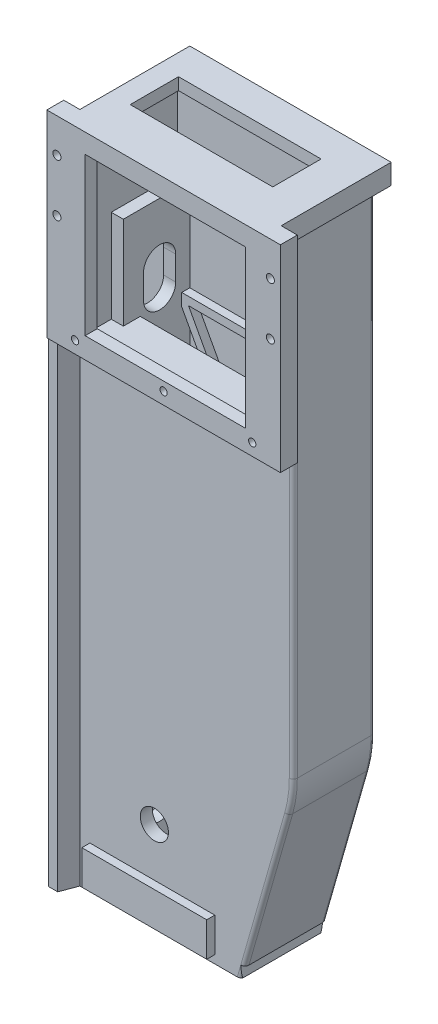
from build123d import *
from OCP.BRepFilletAPI import BRepFilletAPI_MakeChamfer

# Parameters (mm, degrees)
EXTRUDE_1_DEPTH     = 50
EXTRUDE_2_DEPTH     = 440
SKETCH_6_W          = 490
SKETCH_6_H          = 203
EXTRUDE_3_DEPTH     = 1220
CUT_EXTRUDE_3_REACH = 1785.009
FILLET_1_R          = 300
FILLET_5_R          = 10
FILLET_6_R          = 10
SKETCH_8_W          = 120
SKETCH_8_H          = 1450
CUT_EXTRUDE_4_DEPTH = 30
SHELL_START         = -255
SHELL_3_DEPTH       = 143
SHELL_START_2       = -112
SHELL_3_2_DEPTH     = 82
SHELL_START_3       = -90
SHELL_3_3_OUTLINE_W = 30
SHELL_3_3_OUTLINE_H = 230
SHELL_3_3_DEPTH     = 60
EXTRUDE_4_DEPTH     = 1450
EXTRUDE_7_DEPTH     = 1450
SKETCH_13_R         = 35
CUT_EXTRUDE_5_DEPTH = 1784.008936163
SKETCH_3_W          = 354
SKETCH_3_H          = 120
CUT_EXTRUDE_1_DEPTH = 50
CUT_EXTRUDE_6_REACH = 1796.449
SKETCH_15_W         = 398
SKETCH_15_H         = 390
CUT_EXTRUDE_7_REACH = 1820.337
SKETCH_18_W         = 270
SKETCH_18_H         = 143
SKETCH_18_W_2       = 180
SKETCH_18_H_2       = 123
EXTRUDE_8_DEPTH     = 30
HOLE_WIZARD_M16_1_D = 14
CHAMFER_1_SIZE      = 2
CHAMFER_1_SIZE2     = 1.480874037
RIB_10_REACH        = 1777.703
SKETCH_25_WALLS_W   = 3953.405843571
SKETCH_25_WALLS_H   = 20
SKETCH_25_WALLS_W_2 = 3946.405843571
RIB_11_REACH        = 1777.703
RIB_12_REACH        = 1775.472
SKETCH_27_WALLS_W   = 3948.943538561
SKETCH_27_WALLS_H   = 20
RIB_13_REACH        = 1775.472
SKETCH_30_W         = 310
SKETCH_30_H         = 85
EXTRUDE_9_DEPTH     = 20
CUT_EXTRUDE_8_REACH = 1796.449
SKETCH_31_R         = 9
SKETCH_31_R_2       = 10
SKETCH_32_R         = 7
CUT_EXTRUDE_9_DEPTH = 30


# Read off the part's stored shape, not the designer's step: 抽壳3
with BuildPart() as part:
    # 草图2 → 凸台-拉伸1 (new body)
    with BuildSketch(Plane(origin=(0, 0, 0), x_dir=(1, 0, 0), z_dir=(0, 1, 0))):
        Polygon((-163.111685896, 0), (416.888314104, 0), (416.888314104, 42), (376.888314104, 42), (376.888314104, 315), (-123.111685896, 315), (-123.111685896, 42), (-163.111685896, 42), align=None)
    extrude(amount=-EXTRUDE_1_DEPTH)

    # 草图5 → 凸台-拉伸2 (add)
    with BuildSketch(Plane.XZ.offset(50)):
        Polygon((-123.111685896, -285), (366.888314104, -285), (366.888314104, -42), (416.888314104, -42), (416.888314104, 0), (-163.111685896, 0), (-163.111685896, -42), (-123.111685896, -42), align=None)
    extrude(amount=EXTRUDE_2_DEPTH)

    # 草图6 → 凸台-拉伸3 (add)
    with BuildSketch(Plane.XZ.offset(490)):
        with Locations((121.888314104, -183.5)):
            Rectangle(SKETCH_6_W, SKETCH_6_H)
    extrude(amount=EXTRUDE_3_DEPTH)

    # 草图7 → 切除-拉伸3 (cut, up to next)
    with BuildSketch(Plane(origin=(0, 0, -285), x_dir=(-1, 0, 0), z_dir=(0, 0, -1)), mode=Mode.PRIVATE) as cut_extrude_3_sk1:
        Polygon((-236.888314104, -1680), (-246.888314104, -1680), (-366.888314104, -1260), (-366.888314104, -1710), (-236.888314104, -1710), align=None)
    cut_extrude_3_tool1 = extrude(cut_extrude_3_sk1.sketch, amount=-CUT_EXTRUDE_3_REACH, mode=Mode.PRIVATE) & part.part
    add(cut_extrude_3_tool1.solids().sort_by_distance((323.537799, -1560.773196, -285))[0], mode=Mode.SUBTRACT)

    # 圆角1
    fillet_1_edges = [part.edges().sort_by_distance(p)[0] for p in [
        (366.888314104, -1260, -183.5),
    ]]
    fillet(fillet_1_edges, radius=FILLET_1_R)

    # 圆角5
    fillet_5_edges = [part.edges().sort_by_distance(p)[0] for p in [
        (366.888314104, -633.991758304, -285),
        (363.988596237, -1259.593880175, -285),
        (301.11690625, -1490.199927489, -285),
    ]]
    fillet(fillet_5_edges, radius=FILLET_5_R)

    # 圆角6
    fillet_6_edges = [part.edges().sort_by_distance(p)[0] for p in [
        (301.11690625, -1490.199927489, -82),
        (363.988596237, -1259.593880175, -82),
        (366.888314104, -853.991758304, -82),
    ]]
    fillet(fillet_6_edges, radius=FILLET_6_R)

    # 草图8 → 切除-拉伸4 (cut)
    with BuildSketch(Plane.ZY.offset(123.111685896)):
        with Locations((-180, -985)):
            Rectangle(SKETCH_8_W, SKETCH_8_H)
    extrude(amount=-CUT_EXTRUDE_4_DEPTH, mode=Mode.SUBTRACT)

    # 抽壳3 outline → 抽壳3 (cut)
    with BuildSketch(Plane.XY.offset(SHELL_START)):
        with BuildLine():
            Line((336.888314104, -30), (-93.111685896, -30))
            Line((-93.111685896, -30), (-93.111685896, -230))
            Line((-93.111685896, -230), (-63.111685896, -230))
            Line((-63.111685896, -230), (-63.111685896, -1710))
            Line((-63.111685896, -1710), (206.888314104, -1710))
            Line((206.888314104, -1710), (206.888314104, -1650))
            Line((206.888314104, -1650), (224.259271721, -1650))
            Line((224.259271721, -1650), (326.499779967, -1292.15822114))
            ThreePointArc((326.499779967, -1292.15822114), (334.278568024, -1255.432843818), (336.888314104, -1217.983516608))
            Line((336.888314104, -1217.983516608), (336.888314104, -30))
        make_face()
    extrude(amount=SHELL_3_DEPTH, mode=Mode.SUBTRACT)

    # Shell 3 2 outline → Shell 3 2 (cut)
    with BuildSketch(Plane.XY.offset(SHELL_START_2)):
        Polygon((336.888314104, -460), (336.888314104, -30), (-93.111685896, -30), (-93.111685896, -230), (-63.111685896, -230), (-63.111685896, -460), align=None)
    extrude(amount=SHELL_3_2_DEPTH, mode=Mode.SUBTRACT)

    # Shell 3 3 outline → Shell 3 3 (cut)
    with BuildSketch(Plane.XY.offset(SHELL_START_3)):
        with Locations((-78.111685896, -345)):
            Rectangle(SHELL_3_3_OUTLINE_W, SHELL_3_3_OUTLINE_H)
    extrude(amount=SHELL_3_3_DEPTH, mode=Mode.SUBTRACT)

    # 草图9 → 凸台-拉伸4 (add)
    with BuildSketch(Plane(origin=(0, -260, 0), x_dir=(1, 0, 0), z_dir=(0, 1, 0))):
        Polygon((-123.111685896, 285), (-153.111685896, 285), (-168.111685896, 319.5), (-198.111685896, 319.5), (-198.111685896, 349.5), (-228.111685896, 349.5), (-228.111685896, 227.5), (-191.111685896, 227.5), (-191.111685896, 240), (-123.111685896, 240), align=None)
    extrude(amount=-EXTRUDE_4_DEPTH)

    # 草图12 → 凸台-拉伸7 (add)
    with BuildSketch(Plane.XZ.offset(1710)):
        Polygon((-123.111685896, -82), (-163.111685896, -82), (-178.111685896, -42), (-203.111685896, -42), (-203.111685896, -82), (-198.686479123, -84.327562032), (-201.014041155, -88.752768805), (-228.111685896, -74.5), (-228.111685896, -139.5), (-191.111685896, -139.5), (-191.111685896, -127), (-176.111685896, -127), (-176.111685896, -120), (-123.111685896, -120), align=None)
    extrude(amount=-EXTRUDE_7_DEPTH)

    # 草图13 → 切除-拉伸5 (cut, through all)
    with BuildSketch(Plane(origin=(0, 0, -285), x_dir=(-1, 0, 0), z_dir=(0, 0, -1))):
        with Locations((-21.888314104, -1485)):
            Circle(SKETCH_13_R)
        with Locations((-21.888314104, -265)):
            Circle(SKETCH_13_R)
    extrude(amount=-CUT_EXTRUDE_5_DEPTH, mode=Mode.SUBTRACT)

    # 草图3 → 切除-拉伸1 (cut)
    with BuildSketch(Plane(origin=(0, 0, 0), x_dir=(1, 0, 0), z_dir=(0, 1, 0))):
        with Locations((105.888314104, 175)):
            Rectangle(SKETCH_3_W, SKETCH_3_H)
    extrude(amount=-CUT_EXTRUDE_1_DEPTH, mode=Mode.SUBTRACT)

    # 草图15 → 切除-拉伸6 (cut, up to next)
    with BuildSketch(Plane.XY, mode=Mode.PRIVATE) as cut_extrude_6_sk1:
        with Locations((130.888314104, -243)):
            Rectangle(SKETCH_15_W, SKETCH_15_H)
    cut_extrude_6_tool1 = extrude(cut_extrude_6_sk1.sketch, amount=-CUT_EXTRUDE_6_REACH, mode=Mode.PRIVATE) & part.part
    add(cut_extrude_6_tool1.solids().sort_by_distance((130.888314, -243, 0))[0], mode=Mode.SUBTRACT)

    # 草图17 → 切除-拉伸7 (cut, up to next)
    with BuildSketch(Plane.ZY.offset(93.111685896), mode=Mode.PRIVATE) as cut_extrude_7_sk1:
        with BuildLine():
            Line((-140, -370), (-140, -430))
            ThreePointArc((-140, -430), (-180, -470), (-220, -430))
            Line((-220, -430), (-220, -370))
            ThreePointArc((-220, -370), (-180, -330), (-140, -370))
        make_face()
    cut_extrude_7_tool1 = extrude(cut_extrude_7_sk1.sketch, amount=-CUT_EXTRUDE_7_REACH, mode=Mode.PRIVATE) & part.part
    # 草图17 → 切除-拉伸7 (cut, up to next)
    with BuildSketch(Plane.ZY.offset(93.111685896), mode=Mode.PRIVATE) as cut_extrude_7_sk2:
        with BuildLine():
            Line((-140, -600), (-140, -720))
            ThreePointArc((-140, -720), (-180, -760), (-220, -720))
            Line((-220, -720), (-220, -600))
            ThreePointArc((-220, -600), (-180, -560), (-140, -600))
        make_face()
    cut_extrude_7_tool2 = extrude(cut_extrude_7_sk2.sketch, amount=-CUT_EXTRUDE_7_REACH, mode=Mode.PRIVATE) & part.part
    # 草图17 → 切除-拉伸7 (cut, up to next)
    with BuildSketch(Plane.ZY.offset(93.111685896), mode=Mode.PRIVATE) as cut_extrude_7_sk3:
        with BuildLine():
            Line((-140, -1120), (-140, -1000))
            ThreePointArc((-140, -1000), (-180, -960), (-220, -1000))
            Line((-220, -1000), (-220, -1120))
            ThreePointArc((-220, -1120), (-180, -1160), (-140, -1120))
        make_face()
    cut_extrude_7_tool3 = extrude(cut_extrude_7_sk3.sketch, amount=-CUT_EXTRUDE_7_REACH, mode=Mode.PRIVATE) & part.part
    # 草图17 → 切除-拉伸7 (cut, up to next)
    with BuildSketch(Plane.ZY.offset(93.111685896), mode=Mode.PRIVATE) as cut_extrude_7_sk4:
        with BuildLine():
            Line((-140, -1530), (-140, -1430))
            ThreePointArc((-140, -1430), (-180, -1390), (-220, -1430))
            Line((-220, -1430), (-220, -1530))
            ThreePointArc((-220, -1530), (-180, -1570), (-140, -1530))
        make_face()
    cut_extrude_7_tool4 = extrude(cut_extrude_7_sk4.sketch, amount=-CUT_EXTRUDE_7_REACH, mode=Mode.PRIVATE) & part.part
    add(cut_extrude_7_tool1.solids().sort_by_distance((-93.111686, -400, -180))[0], mode=Mode.SUBTRACT)
    add(cut_extrude_7_tool2.solids().sort_by_distance((-93.111686, -660, -180))[0], mode=Mode.SUBTRACT)
    add(cut_extrude_7_tool3.solids().sort_by_distance((-93.111686, -1060, -180))[0], mode=Mode.SUBTRACT)
    add(cut_extrude_7_tool4.solids().sort_by_distance((-93.111686, -1480, -180))[0], mode=Mode.SUBTRACT)

    # 草图18 → 凸台-拉伸8 (add)
    with BuildSketch(Plane.XZ.offset(1710)):
        with Locations((71.888314104, -183.5)):
            Rectangle(SKETCH_18_W, SKETCH_18_H)
        with Locations((91.888314104, -183.5)):
            Rectangle(SKETCH_18_W_2, SKETCH_18_H_2, mode=Mode.SUBTRACT)
    extrude(amount=-EXTRUDE_8_DEPTH)

    # M16 螺纹孔1 (through all)
    with Locations(Plane(origin=(0, -1710, 0), x_dir=(-1, 0, 0), z_dir=(0, -1, 0))):
        with Locations((46.144651594, 221.995118011)):
            Hole(HOLE_WIZARD_M16_1_D / 2)

    # 倒角1: one chamfer whose edges measure the first distance from different faces: ONE call of the kernel's chamfer builder (chamfer() names one face for all edges)
    chamfer_1_edges_1 = [part.edges().sort_by_distance(p)[0] for p in [
        (-228.111685896, -985, -349.5),
        (-228.111685896, -985, -227.5),
        (-203.111685896, -985, -42),
        (-228.111685896, -985, -139.5),
    ]]
    chamfer_1_edges_2 = [part.edges().sort_by_distance(p)[0] for p in [
        (-228.111685896, -985, -74.5),
    ]]
    chamfer_1_side_2 = [part.faces().sort_by_distance(p)[0] for p in [
        (-228.111685896, -985, -107),
    ]]
    chamfer_1 = BRepFilletAPI_MakeChamfer(part.part.solid().wrapped)
    for e in chamfer_1_edges_1:
        chamfer_1.Add(CHAMFER_1_SIZE, e.wrapped)
    for e in chamfer_1_edges_2:
        chamfer_1.Add(CHAMFER_1_SIZE, CHAMFER_1_SIZE2, e.wrapped, chamfer_1_side_2[0].wrapped)  # the first distance lies on this face
    add(Compound.cast(chamfer_1.Shape()), mode=Mode.REPLACE)

    # 草图25 walls → 筋10 (add, up to next)
    with BuildSketch(Plane.XY.offset(-235), mode=Mode.PRIVATE) as rib_10_sk1:
        with Locations((136.888314103, -470)):
            Rectangle(SKETCH_25_WALLS_W, SKETCH_25_WALLS_H)
    rib_10_tool1 = extrude(rib_10_sk1.sketch, amount=-RIB_10_REACH, mode=Mode.PRIVATE) - part.part
    # 草图25 walls → 筋10 (add, up to next)
    with BuildSketch(Plane.XY.offset(-235), mode=Mode.PRIVATE) as rib_10_sk2:
        with Locations((140.388314103, -1210)):
            Rectangle(SKETCH_25_WALLS_W_2, SKETCH_25_WALLS_H)
    rib_10_tool2 = extrude(rib_10_sk2.sketch, amount=-RIB_10_REACH, mode=Mode.PRIVATE) - part.part
    add(rib_10_tool1.solids().sort_by_distance((136.888314104, -470, -235))[0])
    add(rib_10_tool2.solids().sort_by_distance((140.388314104, -1210, -235))[0])

    # 草图26 walls → 筋11 (add, up to next)
    with BuildSketch(Plane.XY.offset(-235), mode=Mode.PRIVATE) as rib_11_sk1:
        Polygon((1191.42679062, -2766.726416207), (-900.061461145, 1097.255035402), (-917.650162413, 1087.734657903), (1173.838089352, -2776.246793706), align=None)
    rib_11_tool1 = extrude(rib_11_sk1.sketch, amount=-RIB_11_REACH, mode=Mode.PRIVATE) - part.part
    # 草图26 walls → 筋11 (add, up to next)
    with BuildSketch(Plane.XY.offset(-235), mode=Mode.PRIVATE) as rib_11_sk2:
        Polygon((1172.943753284, 1097.732303328), (-916.761255348, -2768.22196264), (-899.167125076, -2777.732303328), (1190.537883555, 1088.22196264), align=None)
    rib_11_tool2 = extrude(rib_11_sk2.sketch, amount=-RIB_11_REACH, mode=Mode.PRIVATE) - part.part
    add(rib_11_tool1.solids().sort_by_distance((136.888314104, -839.495879152, -235))[0])
    add(rib_11_tool2.solids().sort_by_distance((136.888314104, -840, -235))[0])

    # 草图27 walls → 筋12 (add, up to next)
    with BuildSketch(Plane(origin=(0, 0, -132), x_dir=(-1, 0, 0), z_dir=(0, 0, -1)), mode=Mode.PRIVATE) as rib_12_sk1:
        with Locations((-136.888314103, -470)):
            Rectangle(SKETCH_27_WALLS_W, SKETCH_27_WALLS_H)
    rib_12_tool1 = extrude(rib_12_sk1.sketch, amount=-RIB_12_REACH, mode=Mode.PRIVATE) - part.part
    # 草图27 walls → 筋12 (add, up to next)
    with BuildSketch(Plane(origin=(0, 0, -132), x_dir=(-1, 0, 0), z_dir=(0, 0, -1)), mode=Mode.PRIVATE) as rib_12_sk2:
        with Locations((-136.888314103, -1210)):
            Rectangle(SKETCH_27_WALLS_W, SKETCH_27_WALLS_H)
    rib_12_tool2 = extrude(rib_12_sk2.sketch, amount=-RIB_12_REACH, mode=Mode.PRIVATE) - part.part
    add(rib_12_tool1.solids().sort_by_distance((136.888314104, -470, -132))[0])
    add(rib_12_tool2.solids().sort_by_distance((136.888314104, -1210, -132))[0])

    # 草图29 walls → 筋13 (add, up to next)
    with BuildSketch(Plane(origin=(0, 0, -132), x_dir=(-1, 0, 0), z_dir=(0, 0, -1)), mode=Mode.PRIVATE) as rib_13_sk1:
        Polygon((915.700304326, -2766.25920325), (-1171.882802261, 1095.769543937), (-1189.476932533, 1086.25920325), (898.106174054, -2775.769543937), align=None)
    rib_13_tool1 = extrude(rib_13_sk1.sketch, amount=-RIB_13_REACH, mode=Mode.PRIVATE) - part.part
    # 草图29 walls → 筋13 (add, up to next)
    with BuildSketch(Plane(origin=(0, 0, -132), x_dir=(-1, 0, 0), z_dir=(0, 0, -1)), mode=Mode.PRIVATE) as rib_13_sk2:
        Polygon((898.99939044, 1095.292881658), (-1190.364719915, -2764.764262463), (-1172.776018647, -2774.284639961), (916.588091708, 1085.772504159), align=None)
    rib_13_tool2 = extrude(rib_13_sk2.sketch, amount=-RIB_13_REACH, mode=Mode.PRIVATE) - part.part
    add(rib_13_tool1.solids().sort_by_distance((136.888314104, -840, -132))[0])
    add(rib_13_tool2.solids().sort_by_distance((136.888314104, -839.495879152, -132))[0])

    # 草图30 → 凸台-拉伸9 (add)
    with BuildSketch(Plane.XY.offset(-82)):
        with Locations((16.888314104, -1647.5)):
            Rectangle(SKETCH_30_W, SKETCH_30_H)
    extrude(amount=EXTRUDE_9_DEPTH)

    # 切除-拉伸8: up to this face of the body (flat: up to its plane)
    cut_extrude_8_end = Plane(part.part.faces().sort_by_distance((-143.111685896, -245, -42))[0])
    # 草图31 → 切除-拉伸8 (cut, up to the picked face)
    with BuildSketch(Plane.XY, mode=Mode.PRIVATE) as cut_extrude_8_sk1:
        with Locations((346.888314104, -460)):
            Circle(SKETCH_31_R)
    cut_extrude_8_tool1 = split(extrude(cut_extrude_8_sk1.sketch, amount=-CUT_EXTRUDE_8_REACH, mode=Mode.PRIVATE), bisect_by=cut_extrude_8_end, keep=Keep.BOTH, mode=Mode.PRIVATE)
    # 草图31 → 切除-拉伸8 (cut, up to the picked face)
    with BuildSketch(Plane.XY, mode=Mode.PRIVATE) as cut_extrude_8_sk2:
        with Locations((126.888314104, -460)):
            Circle(SKETCH_31_R)
    cut_extrude_8_tool2 = split(extrude(cut_extrude_8_sk2.sketch, amount=-CUT_EXTRUDE_8_REACH, mode=Mode.PRIVATE), bisect_by=cut_extrude_8_end, keep=Keep.BOTH, mode=Mode.PRIVATE)
    # 草图31 → 切除-拉伸8 (cut, up to the picked face)
    with BuildSketch(Plane.XY, mode=Mode.PRIVATE) as cut_extrude_8_sk3:
        with Locations((-93.111685896, -460)):
            Circle(SKETCH_31_R)
    cut_extrude_8_tool3 = split(extrude(cut_extrude_8_sk3.sketch, amount=-CUT_EXTRUDE_8_REACH, mode=Mode.PRIVATE), bisect_by=cut_extrude_8_end, keep=Keep.BOTH, mode=Mode.PRIVATE)
    # 草图31 → 切除-拉伸8 (cut, up to the picked face)
    with BuildSketch(Plane.XY, mode=Mode.PRIVATE) as cut_extrude_8_sk4:
        with Locations((-138.111685896, -215)):
            Circle(SKETCH_31_R_2)
    cut_extrude_8_tool4 = split(extrude(cut_extrude_8_sk4.sketch, amount=-CUT_EXTRUDE_8_REACH, mode=Mode.PRIVATE), bisect_by=cut_extrude_8_end, keep=Keep.BOTH, mode=Mode.PRIVATE)
    # 草图31 → 切除-拉伸8 (cut, up to the picked face)
    with BuildSketch(Plane.XY, mode=Mode.PRIVATE) as cut_extrude_8_sk5:
        with Locations((-138.111685896, -85)):
            Circle(SKETCH_31_R_2)
    cut_extrude_8_tool5 = split(extrude(cut_extrude_8_sk5.sketch, amount=-CUT_EXTRUDE_8_REACH, mode=Mode.PRIVATE), bisect_by=cut_extrude_8_end, keep=Keep.BOTH, mode=Mode.PRIVATE)
    # 草图31 → 切除-拉伸8 (cut, up to the picked face)
    with BuildSketch(Plane.XY, mode=Mode.PRIVATE) as cut_extrude_8_sk6:
        with Locations((391.888314104, -215)):
            Circle(SKETCH_31_R_2)
    cut_extrude_8_tool6 = split(extrude(cut_extrude_8_sk6.sketch, amount=-CUT_EXTRUDE_8_REACH, mode=Mode.PRIVATE), bisect_by=cut_extrude_8_end, keep=Keep.BOTH, mode=Mode.PRIVATE)
    # 草图31 → 切除-拉伸8 (cut, up to the picked face)
    with BuildSketch(Plane.XY, mode=Mode.PRIVATE) as cut_extrude_8_sk7:
        with Locations((391.888314104, -85)):
            Circle(SKETCH_31_R_2)
    cut_extrude_8_tool7 = split(extrude(cut_extrude_8_sk7.sketch, amount=-CUT_EXTRUDE_8_REACH, mode=Mode.PRIVATE), bisect_by=cut_extrude_8_end, keep=Keep.BOTH, mode=Mode.PRIVATE)
    add(cut_extrude_8_tool1.solids().sort_by(Axis((346.888314, -460, 0), (0, 0, -1)))[0], mode=Mode.SUBTRACT)
    add(cut_extrude_8_tool2.solids().sort_by(Axis((126.888314, -460, 0), (0, 0, -1)))[0], mode=Mode.SUBTRACT)
    add(cut_extrude_8_tool3.solids().sort_by(Axis((-93.111686, -460, 0), (0, 0, -1)))[0], mode=Mode.SUBTRACT)
    add(cut_extrude_8_tool4.solids().sort_by(Axis((-138.111686, -215, 0), (0, 0, -1)))[0], mode=Mode.SUBTRACT)
    add(cut_extrude_8_tool5.solids().sort_by(Axis((-138.111686, -85, 0), (0, 0, -1)))[0], mode=Mode.SUBTRACT)
    add(cut_extrude_8_tool6.solids().sort_by(Axis((391.888314, -215, 0), (0, 0, -1)))[0], mode=Mode.SUBTRACT)
    add(cut_extrude_8_tool7.solids().sort_by(Axis((391.888314, -85, 0), (0, 0, -1)))[0], mode=Mode.SUBTRACT)

    # 草图32 → 切除-拉伸9 (cut)
    with BuildSketch(Plane.XZ.offset(1710)):
        with Locations(Location((-188.111685896, -112, 0), (0, 0, 270))):
            Circle(SKETCH_32_R)
        with Locations(Location((141.888314104, -107, 0), (0, 0, 270))):
            Circle(SKETCH_32_R)
    extrude(amount=-CUT_EXTRUDE_9_DEPTH, mode=Mode.SUBTRACT)


solid = part.part
